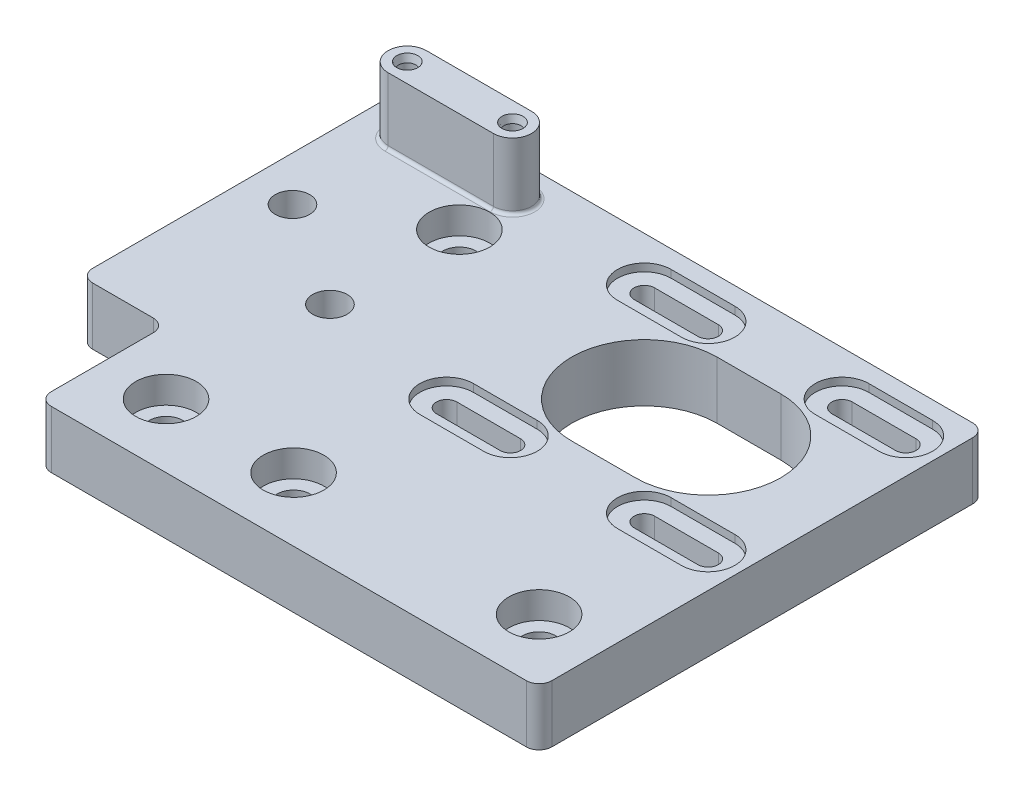
from build123d import *

# Parameters (mm, degrees)
SKETCH3_R           = 2.6
SKETCH3_R_2         = 2.7
BOSS_EXTRUDE1_DEPTH = 9
SKETCH5_R           = 4.75
CUT_EXTRUDE2_DEPTH  = 2.2
SKETCH6_R           = 4.75
CUT_EXTRUDE3_DEPTH  = 2
FILLET1_R           = 2
SKETCH7_R           = 1.35
BOSS_EXTRUDE2_DEPTH = 10.4
FILLET2_R           = 0.5
CHAMFER1_SIZE       = 0.3
CHAMFER1_SIZE2      = 1.119615242
CUT_EXTRUDE4_DEPTH  = 1.2
CUT_EXTRUDE8_DEPTH  = 0.4


# Read off the part's stored shape, not the designer's step: Cut-Extrude8
with BuildPart() as part:
    # Sketch3 → Boss-Extrude1 (new body)
    with BuildSketch(Plane(origin=(0, 0, 0), x_dir=(1, 0, 0), z_dir=(0, 1, 0))):
        Polygon((0, 0), (78.5, 0), (78.5, 70), (0, 70), (-13.5, 70), (-13.5, 20), (0, 20), align=None)
        with Locations(Location((10, 56, 0), (0, 0, 270))):
            Circle(SKETCH3_R, mode=Mode.SUBTRACT)
        with Locations(Location((10, 10, 0), (0, 0, 270))):
            Circle(SKETCH3_R, mode=Mode.SUBTRACT)
        with Locations(Location((68.5, 10, 0), (0, 0, 270))):
            Circle(SKETCH3_R, mode=Mode.SUBTRACT)
        with Locations(Location((10, 35.7, 0), (0, 0, 270))):
            Circle(SKETCH3_R_2, mode=Mode.SUBTRACT)
        with Locations(Location((-6.5, 46.325, 0), (0, 0, 270))):
            Circle(SKETCH3_R_2, mode=Mode.SUBTRACT)
        with Locations(Location((30, 10, 0), (0, 0, 270))):
            Circle(SKETCH3_R, mode=Mode.SUBTRACT)
        with BuildLine():
            Line((47.5, 58.9), (57.5, 58.9))
            ThreePointArc((57.5, 58.9), (68.9, 47.5), (57.5, 36.1))
            Line((57.5, 36.1), (47.5, 36.1))
            ThreePointArc((47.5, 36.1), (36.1, 47.5), (47.5, 58.9))
        make_face(mode=Mode.SUBTRACT)
        with BuildLine():
            Line((32, 64.6), (42, 64.6))
            ThreePointArc((42, 64.6), (43.6, 63), (42, 61.4))
            Line((42, 61.4), (32, 61.4))
            ThreePointArc((32, 61.4), (30.4, 63), (32, 64.6))
        make_face(mode=Mode.SUBTRACT)
        with BuildLine():
            Line((63, 64.6), (73, 64.6))
            ThreePointArc((73, 64.6), (74.6, 63), (73, 61.4))
            Line((73, 61.4), (63, 61.4))
            ThreePointArc((63, 61.4), (61.4, 63), (63, 64.6))
        make_face(mode=Mode.SUBTRACT)
        with BuildLine():
            Line((63, 33.6), (73, 33.6))
            ThreePointArc((73, 33.6), (74.6, 32), (73, 30.4))
            Line((73, 30.4), (63, 30.4))
            ThreePointArc((63, 30.4), (61.4, 32), (63, 33.6))
        make_face(mode=Mode.SUBTRACT)
        with BuildLine():
            Line((32, 33.6), (42, 33.6))
            ThreePointArc((42, 33.6), (43.6, 32), (42, 30.4))
            Line((42, 30.4), (32, 30.4))
            ThreePointArc((32, 30.4), (30.4, 32), (32, 33.6))
        make_face(mode=Mode.SUBTRACT)
    extrude(amount=BOSS_EXTRUDE1_DEPTH)

    # Sketch5 → Cut-Extrude2 (cut)
    with BuildSketch(Plane(origin=(0, 9, 0), x_dir=(1, 0, 0), z_dir=(0, 1, 0))):
        with Locations(Location((10, 56, 0), (0, 0, 270))):
            Circle(SKETCH5_R)
        with Locations(Location((10, 10, 0), (0, 0, 270))):
            Circle(SKETCH5_R)
        with Locations(Location((30, 10, 0), (0, 0, 270))):
            Circle(SKETCH5_R)
        with Locations(Location((68.5, 10, 0), (0, 0, 270))):
            Circle(SKETCH5_R)
    extrude(amount=-CUT_EXTRUDE2_DEPTH, mode=Mode.SUBTRACT)

    # Sketch6 → Cut-Extrude3 (cut)
    with BuildSketch(Plane(origin=(0, 6.8, 0), x_dir=(1, 0, 0), z_dir=(0, 1, 0))):
        with Locations(Location((68.5, 10, 0), (0, 0, 270))):
            Circle(SKETCH6_R)
        with Locations(Location((30, 10, 0), (0, 0, 270))):
            Circle(SKETCH6_R)
        with Locations(Location((10, 10, 0), (0, 0, 270))):
            Circle(SKETCH6_R)
        with Locations(Location((10, 56, 0), (0, 0, 270))):
            Circle(SKETCH6_R)
    extrude(amount=-CUT_EXTRUDE3_DEPTH, mode=Mode.SUBTRACT)

    # Fillet1
    fillet1_edges = [part.edges().sort_by_distance(p)[0] for p in [
        (0, 4.5, -20),
        (-13.5, 4.5, -20),
        (-13.5, 4.5, -70),
        (78.5, 4.5, -70),
        (78.5, 4.5, 0),
        (0, 4.5, 0),
    ]]
    fillet(fillet1_edges, radius=FILLET1_R)

    # Sketch7 → Boss-Extrude2 (add)
    with BuildSketch(Plane(origin=(0, 9, 0), x_dir=(1, 0, 0), z_dir=(0, 1, 0))):
        with BuildLine():
            Line((-6.5, 67.325), (10, 67.325))
            ThreePointArc((10, 67.325), (13, 64.325), (10, 61.325))
            Line((10, 61.325), (-6.5, 61.325))
            ThreePointArc((-6.5, 61.325), (-9.5, 64.325), (-6.5, 67.325))
        make_face()
        with Locations(Location((-6.5, 64.325, 0), (0, 0, 270))):
            Circle(SKETCH7_R, mode=Mode.SUBTRACT)
        with Locations(Location((10, 64.325, 0), (0, 0, 270))):
            Circle(SKETCH7_R, mode=Mode.SUBTRACT)
    extrude(amount=BOSS_EXTRUDE2_DEPTH)

    # Fillet2
    fillet2_edges = [part.edges().sort_by_distance(p)[0] for p in [
        (-9.5, 9, -64.325),
        (1.75, 9, -61.325),
        (13, 9, -64.325),
        (1.75, 9, -67.325),
    ]]
    fillet(fillet2_edges, radius=FILLET2_R)

    # Chamfer1
    chamfer1_edges = [part.edges().sort_by_distance(p)[0] for p in [
        (-6.5, 19.4, -65.675),
        (10, 19.4, -65.675),
    ]]
    chamfer1_side = [part.faces().sort_by_distance(p)[0] for p in [
        (1.75, 19.4, -64.325),
    ]]
    chamfer(chamfer1_edges, length=CHAMFER1_SIZE, length2=CHAMFER1_SIZE2, reference=chamfer1_side[0])

    # Sketch8 → Cut-Extrude4 (cut)
    with BuildSketch(Plane(origin=(0, 9, 0), x_dir=(1, 0, 0), z_dir=(0, 1, 0))):
        with BuildLine():
            Line((73, 27.8), (63, 27.8))
            ThreePointArc((63, 27.8), (58.8, 32), (63, 36.2))
            Line((63, 36.2), (73, 36.2))
            ThreePointArc((73, 36.2), (77.2, 32), (73, 27.8))
        make_face()
        with BuildLine():
            Line((42, 27.8), (32, 27.8))
            ThreePointArc((32, 27.8), (27.8, 32), (32, 36.2))
            Line((32, 36.2), (42, 36.2))
            ThreePointArc((42, 36.2), (46.2, 32), (42, 27.8))
        make_face()
        with BuildLine():
            Line((42, 58.8), (32, 58.8))
            ThreePointArc((32, 58.8), (27.8, 63), (32, 67.2))
            Line((32, 67.2), (42, 67.2))
            ThreePointArc((42, 67.2), (46.2, 63), (42, 58.8))
        make_face()
        with BuildLine():
            Line((63, 67.2), (73, 67.2))
            ThreePointArc((73, 67.2), (77.2, 63), (73, 58.8))
            Line((73, 58.8), (63, 58.8))
            ThreePointArc((63, 58.8), (58.8, 63), (63, 67.2))
        make_face()
    extrude(amount=-CUT_EXTRUDE4_DEPTH, mode=Mode.SUBTRACT)

    # Cut-Extrude8 outline → Cut-Extrude8 (cut)
    # profile 1 of 5: a face of its own
    with BuildSketch(Plane(origin=(0, 0, 0), x_dir=(1, 0, 0), z_dir=(0, 1, 0))):
        with BuildLine():
            add(Edge.make_bspline(
                [(-7.865534856, 29.499038462), (-7.898701426, 29.499773867), (-7.964684743, 29.501236921), (-8.061387338, 29.520421256), (-8.155129491, 29.54792403), (-8.244842381, 29.587854753), (-8.330709621, 29.639591182), (-8.413673167, 29.701995481), (-8.492661015, 29.776846195), (-8.568080669, 29.860679805), (-8.636691682, 29.953510963), (-8.696737672, 30.053174237), (-8.747675208, 30.159265502), (-8.78981842, 30.27110517), (-8.821485046, 30.389214426), (-8.844231309, 30.512994831), (-8.858450312, 30.642694489), (-8.860497684, 30.731180266), (-8.861538462, 30.776161859)],
                knots=[0, 0, 0, 0, 0.055270353, 0.109957746, 0.163912222, 0.218089001, 0.273309497, 0.330913549, 0.390994211, 0.454640742, 0.518898068, 0.583342166, 0.648543366, 0.715052521, 0.782518585, 0.852333896, 0.924934189, 1, 1, 1, 1], degree=3))
            add(Edge.make_bspline(
                [(-8.861538462, 30.776161859), (-8.859014133, 30.848464171), (-8.854083533, 30.989687402), (-8.810898066, 31.193277323), (-8.741994972, 31.3825424), (-8.659747922, 31.527211124), (-8.578557849, 31.634040937), (-8.507651234, 31.710380525), (-8.428851682, 31.785347737), (-8.337305773, 31.854010608), (-8.239213168, 31.923450537), (-8.129587346, 31.986668527), (-8.011287945, 32.048099683), (-7.927657293, 32.085115737), (-7.884615385, 32.104166667)],
                knots=[0, 0, 0, 0, 0.122711942, 0.239684964, 0.351815855, 0.463766133, 0.520817793, 0.579448291, 0.640604145, 0.705297512, 0.773633881, 0.844669382, 0.920056508, 1, 1, 1, 1], degree=3))
            Line((-7.884615385, 32.104166667), (-7.884615385, 32.674038462))
            add(Edge.make_bspline(
                [(-7.884615385, 32.674038462), (-7.948537177, 32.658599705), (-8.073499053, 32.6284182), (-8.25203794, 32.565466888), (-8.420990615, 32.496888239), (-8.577193491, 32.414539435), (-8.723785786, 32.32471641), (-8.857442626, 32.221805186), (-8.981563292, 32.11055369), (-9.091714452, 31.987499853), (-9.191459761, 31.858452138), (-9.276504507, 31.721592185), (-9.349664042, 31.579673507), (-9.409935034, 31.431712823), (-9.455338484, 31.277269625), (-9.488280117, 31.117740166), (-9.509672567, 30.952706387), (-9.51176038, 30.840678616), (-9.512820513, 30.783794071)],
                knots=[0, 0, 0, 0, 0.072625346, 0.141976611, 0.208984928, 0.27395687, 0.336889347, 0.398744953, 0.460115885, 0.520824923, 0.580994459, 0.640151928, 0.698622451, 0.757271081, 0.816426694, 0.876254048, 0.937165293, 1, 1, 1, 1], degree=3))
            add(Edge.make_bspline(
                [(-9.512820513, 30.783794071), (-9.510318195, 30.700912524), (-9.505368142, 30.536957319), (-9.460166236, 30.296087219), (-9.388637782, 30.06380999), (-9.289806877, 29.842668069), (-9.167909894, 29.637257484), (-9.022831015, 29.45449326), (-8.857369425, 29.296852676), (-8.674611772, 29.164601448), (-8.47929392, 29.061051092), (-8.278270777, 28.984694386), (-8.072019201, 28.938209336), (-7.932759566, 28.932184898), (-7.862990785, 28.929166667)],
                knots=[0, 0, 0, 0, 0.090254249, 0.178539792, 0.266093034, 0.354630978, 0.441886153, 0.525746915, 0.608113634, 0.690197273, 0.770821484, 0.848326181, 0.92401174, 1, 1, 1, 1], degree=3))
            add(Edge.make_bspline(
                [(-7.862990785, 28.929166667), (-7.795849886, 28.931277753), (-7.664465566, 28.935408822), (-7.472656564, 28.970485688), (-7.291878232, 29.029515765), (-7.121369552, 29.111285191), (-6.962211629, 29.217133432), (-6.814046369, 29.345353897), (-6.676216611, 29.496851583), (-6.597259853, 29.611657656), (-6.556610577, 29.670763221)],
                knots=[0, 0, 0, 0, 0.128067549, 0.250608319, 0.370630166, 0.490072247, 0.610374764, 0.73431307, 0.863216504, 1, 1, 1, 1], degree=3))
            add(Edge.make_bspline(
                [(-6.556610577, 29.670763221), (-6.524111282, 29.60312808), (-6.459616424, 29.468906131), (-6.331122433, 29.28780155), (-6.186406305, 29.120890011), (-6.072210892, 29.028900677), (-6.014723558, 28.982592147)],
                knots=[0, 0, 0, 0, 0.253915889, 0.50389613, 0.750255389, 1, 1, 1, 1], degree=3))
            add(Edge.make_bspline(
                [(-6.014723558, 28.982592147), (-5.972890208, 28.952037141), (-5.88990856, 28.891427486), (-5.756492473, 28.816614447), (-5.621597628, 28.748743625), (-5.48160842, 28.695856798), (-5.338147381, 28.654901354), (-5.190968176, 28.625625981), (-5.039950621, 28.607439326), (-4.937783693, 28.604834824), (-4.886428285, 28.603525641)],
                knots=[0, 0, 0, 0, 0.12813551, 0.254172712, 0.378111645, 0.501712263, 0.623986309, 0.747095614, 0.872874637, 1, 1, 1, 1], degree=3))
            add(Edge.make_bspline(
                [(-4.886428285, 28.603525641), (-4.797511103, 28.60678187), (-4.620095184, 28.613279006), (-4.357969942, 28.671336502), (-4.101773115, 28.761376538), (-3.856606129, 28.889099604), (-3.627439789, 29.045462257), (-3.420883147, 29.229429791), (-3.246118586, 29.44363225), (-3.098329118, 29.680306564), (-2.981291575, 29.937824375), (-2.896935169, 30.212135203), (-2.846338267, 30.501651577), (-2.840267173, 30.699637353), (-2.837179487, 30.800330529)],
                knots=[0, 0, 0, 0, 0.079641442, 0.15890809, 0.239599009, 0.322581849, 0.405999924, 0.487842619, 0.569675599, 0.653019991, 0.737412348, 0.822558452, 0.909755371, 1, 1, 1, 1], degree=3))
            add(Edge.make_bspline(
                [(-2.837179487, 30.800330529), (-2.838768413, 30.868215557), (-2.841894889, 31.001790657), (-2.862887543, 31.198236149), (-2.902271295, 31.385355199), (-2.951801814, 31.564964806), (-3.020283305, 31.734354225), (-3.10192593, 31.895959963), (-3.198823306, 32.049073648), (-3.311138386, 32.192785987), (-3.436858322, 32.326943442), (-3.578071675, 32.448128124), (-3.732142914, 32.557680815), (-3.900457934, 32.654905429), (-4.082545311, 32.740211148), (-4.279134699, 32.811762186), (-4.488702053, 32.87423508), (-4.634705154, 32.903337545), (-4.709615385, 32.918269231)],
                knots=[0, 0, 0, 0, 0.065537725, 0.128956388, 0.190367128, 0.249965467, 0.308568754, 0.366415243, 0.424556413, 0.483181137, 0.542251435, 0.60174426, 0.662507715, 0.724499557, 0.789138915, 0.856353952, 0.92629911, 1, 1, 1, 1], degree=3))
            Line((-4.709615385, 32.918269231), (-4.709615385, 32.348397436))
            add(Edge.make_bspline(
                [(-4.709615385, 32.348397436), (-4.660722175, 32.333550607), (-4.565620635, 32.304672236), (-4.428750366, 32.255515438), (-4.303277898, 32.199511573), (-4.188282805, 32.139432302), (-4.082632589, 32.076334264), (-3.989120913, 32.005731471), (-3.903640474, 31.932853165), (-3.855480964, 31.877917767), (-3.831911058, 31.851031651)],
                knots=[0, 0, 0, 0, 0.149770386, 0.29131641, 0.425966373, 0.552159574, 0.671527414, 0.786121629, 0.895325073, 1, 1, 1, 1], degree=3))
            add(Edge.make_bspline(
                [(-3.831911058, 31.851031651), (-3.804511526, 31.815473891), (-3.749797039, 31.74446813), (-3.679774452, 31.628833937), (-3.619836792, 31.506796701), (-3.57111695, 31.377338716), (-3.534546079, 31.240442617), (-3.508224087, 31.09666371), (-3.490847483, 30.945766092), (-3.489268453, 30.842781417), (-3.488461538, 30.790154247)],
                knots=[0, 0, 0, 0, 0.118260427, 0.236155811, 0.355630221, 0.476249447, 0.60016412, 0.728633077, 0.861326231, 1, 1, 1, 1], degree=3))
            add(Edge.make_bspline(
                [(-3.488461538, 30.790154247), (-3.489578967, 30.730730035), (-3.491764001, 30.614531118), (-3.511858497, 30.444977302), (-3.541123676, 30.28367379), (-3.586322945, 30.132411482), (-3.642168204, 29.98920899), (-3.712287454, 29.856073711), (-3.794555735, 29.731257919), (-3.888062494, 29.616360283), (-3.990427206, 29.513044862), (-4.097493778, 29.42207746), (-4.208810783, 29.344744145), (-4.324994231, 29.282362511), (-4.445563003, 29.233103655), (-4.570855451, 29.199569848), (-4.699846205, 29.176253528), (-4.787528763, 29.174354675), (-4.831730769, 29.173397436)],
                knots=[0, 0, 0, 0, 0.076071737, 0.148751715, 0.218402794, 0.285759581, 0.350598024, 0.414964045, 0.478069339, 0.541760676, 0.604349859, 0.664075021, 0.721463623, 0.777587128, 0.832644447, 0.887843511, 0.943460343, 1, 1, 1, 1], degree=3))
            add(Edge.make_bspline(
                [(-4.831730769, 29.173397436), (-4.890893271, 29.176179682), (-5.008923891, 29.181730331), (-5.182639599, 29.223931247), (-5.350073828, 29.293970624), (-5.50905801, 29.390100998), (-5.654609473, 29.509982861), (-5.785404644, 29.647948337), (-5.893227905, 29.807750794), (-5.967792657, 29.954720369), (-6.01865729, 30.084926283), (-6.052539632, 30.196350532), (-6.081229932, 30.321094901), (-6.107922254, 30.457649487), (-6.13063954, 30.607043631), (-6.149583982, 30.769114562), (-6.164742412, 30.94389516), (-6.171511685, 31.064891989), (-6.175, 31.12724359)],
                knots=[0, 0, 0, 0, 0.066906624, 0.13348033, 0.20102742, 0.271634404, 0.34290514, 0.413858569, 0.4859963, 0.560246393, 0.599899498, 0.644068466, 0.691903727, 0.744697298, 0.801499375, 0.862862948, 0.929331085, 1, 1, 1, 1], degree=3))
            Line((-6.175, 31.12724359), (-6.826282051, 31.12724359))
            add(Edge.make_bspline(
                [(-6.826282051, 31.12724359), (-6.827807352, 31.048711293), (-6.830793996, 30.894939608), (-6.859668198, 30.669723739), (-6.906022646, 30.455277641), (-6.972255149, 30.25468403), (-7.050269039, 30.072203189), (-7.140411935, 29.913250471), (-7.242439135, 29.782010371), (-7.354397218, 29.677111783), (-7.47382099, 29.597381486), (-7.599054077, 29.540041762), (-7.730592943, 29.505867236), (-7.820395835, 29.501322735), (-7.865534856, 29.499038462)],
                knots=[0, 0, 0, 0, 0.110174284, 0.215728893, 0.318103522, 0.417657931, 0.51174192, 0.596260228, 0.673404587, 0.744145217, 0.810661996, 0.874048981, 0.936691285, 1, 1, 1, 1], degree=3))
        make_face()
    # profile 2 of 5: a face of its own
    with BuildSketch(Plane(origin=(0, 0, 0), x_dir=(1, 0, 0), z_dir=(0, 1, 0))):
        with BuildLine():
            add(Edge.make_bspline(
                [(-6.172455929, 33.488141026), (-6.075349118, 33.489336696), (-5.885716922, 33.491671626), (-5.608969538, 33.503439349), (-5.34773633, 33.527173113), (-5.101738784, 33.556427964), (-4.870862844, 33.597445078), (-4.655258951, 33.646867308), (-4.454163768, 33.70317659), (-4.269018116, 33.771516889), (-4.096764894, 33.846694323), (-3.935875438, 33.928403051), (-3.785056859, 34.016067153), (-3.645388142, 34.110982295), (-3.516993672, 34.213543114), (-3.400048027, 34.323232532), (-3.292589626, 34.438717907), (-3.197495953, 34.561561681), (-3.111740809, 34.68799732), (-3.03944429, 34.820159455), (-2.976803597, 34.954665702), (-2.925589054, 35.092858978), (-2.885871577, 35.23452592), (-2.858567975, 35.380137497), (-2.839375639, 35.528823706), (-2.837914073, 35.62933876), (-2.837179487, 35.679857772)],
                knots=[0, 0, 0, 0, 0.065068544, 0.127067203, 0.185531529, 0.240784906, 0.29300424, 0.34255566, 0.388955174, 0.432815094, 0.474671242, 0.514820742, 0.553655081, 0.591478648, 0.627861044, 0.663639447, 0.69882299, 0.733432938, 0.767629982, 0.801074092, 0.834250456, 0.866969953, 0.899711643, 0.932696478, 0.966173152, 1, 1, 1, 1], degree=3))
            add(Edge.make_bspline(
                [(-2.837179487, 35.679857772), (-2.838025589, 35.729939522), (-2.839693937, 35.828690957), (-2.856954564, 35.975017501), (-2.884704978, 36.117044218), (-2.923560813, 36.255471963), (-2.971122031, 36.391010905), (-3.033086516, 36.521814249), (-3.104449964, 36.649335881), (-3.185720862, 36.773237452), (-3.278836096, 36.89118359), (-3.381811162, 37.003865337), (-3.49728669, 37.108347723), (-3.62344464, 37.20612638), (-3.759943205, 37.29778148), (-3.906873989, 37.383325273), (-4.06448788, 37.461929564), (-4.233778283, 37.533872504), (-4.417302079, 37.597657948), (-4.616763138, 37.65378291), (-4.83418739, 37.698608194), (-5.068470928, 37.736604551), (-5.3200898, 37.76705153), (-5.589135037, 37.788264178), (-5.875095745, 37.801123707), (-6.071527096, 37.802286935), (-6.172455929, 37.802884615)],
                knots=[0, 0, 0, 0, 0.033788636, 0.066624595, 0.099289256, 0.131366957, 0.163592401, 0.196112574, 0.228912347, 0.262169615, 0.296004273, 0.330232406, 0.365075923, 0.400968417, 0.437876761, 0.475965588, 0.5156405, 0.556675159, 0.600028359, 0.646689742, 0.696419229, 0.749771655, 0.806850038, 0.867429686, 0.93188375, 1, 1, 1, 1], degree=3))
            add(Edge.make_bspline(
                [(-6.172455929, 37.802884615), (-6.274232619, 37.802289497), (-6.471935304, 37.80113347), (-6.760016012, 37.788273049), (-7.030272537, 37.766909214), (-7.282717812, 37.737631408), (-7.517417018, 37.702002505), (-7.73374292, 37.654440109), (-7.932696827, 37.600351213), (-8.114927234, 37.537663049), (-8.282890212, 37.466928594), (-8.439688197, 37.389938838), (-8.585095732, 37.30364939), (-8.721391513, 37.212953113), (-8.846493921, 37.114319211), (-8.961844371, 37.009862583), (-9.066470092, 36.897494082), (-9.160442732, 36.77830358), (-9.242843024, 36.653098886), (-9.315871013, 36.525301375), (-9.376023779, 36.392627591), (-9.425230397, 36.25682411), (-9.465398894, 36.117604708), (-9.492990537, 35.975004929), (-9.510320284, 35.828694214), (-9.511979196, 35.729940618), (-9.512820513, 35.679857772)],
                knots=[0, 0, 0, 0, 0.068589512, 0.133236115, 0.19429811, 0.251260502, 0.304490752, 0.354208515, 0.400450752, 0.443377719, 0.483978808, 0.523213317, 0.561000573, 0.597855694, 0.63347129, 0.66826456, 0.702637509, 0.736824644, 0.770429956, 0.803571572, 0.835925177, 0.868470046, 0.900853925, 0.933471482, 0.966260089, 1, 1, 1, 1], degree=3))
            add(Edge.make_bspline(
                [(-9.512820513, 35.679857772), (-9.512119745, 35.62933177), (-9.510725464, 35.528802808), (-9.49110012, 35.380711468), (-9.46576912, 35.235199626), (-9.425142369, 35.094474984), (-9.376527191, 34.955876711), (-9.312380237, 34.822851467), (-9.242615443, 34.690702757), (-9.157508262, 34.565433921), (-9.063450823, 34.443302154), (-8.956671582, 34.328816374), (-8.840125669, 34.219050019), (-8.711213768, 34.11814892), (-8.57191248, 34.021788598), (-8.421054061, 33.933626985), (-8.258972832, 33.851830484), (-8.086420179, 33.774861535), (-7.898786953, 33.707554222), (-7.69724347, 33.647712641), (-7.47996466, 33.598662339), (-7.248160901, 33.558098602), (-7.000683842, 33.52661342), (-6.738034899, 33.503699037), (-6.460049755, 33.491590778), (-6.269989027, 33.489310957), (-6.172455929, 33.488141026)],
                knots=[0, 0, 0, 0, 0.033787941, 0.067226111, 0.099841381, 0.132545412, 0.165129805, 0.198010643, 0.231279811, 0.26504391, 0.299215764, 0.33435884, 0.369695008, 0.406257575, 0.443803519, 0.482981531, 0.523084852, 0.565266777, 0.609342883, 0.656392591, 0.705887018, 0.758325752, 0.813832747, 0.872795218, 0.934722568, 1, 1, 1, 1], degree=3))
        make_face()
        with BuildLine():
            add(Edge.make_bspline(
                [(-6.175, 34.058012821), (-6.251322596, 34.059011021), (-6.400625909, 34.060963714), (-6.619280323, 34.068427664), (-6.826957546, 34.087701863), (-7.02455226, 34.109108837), (-7.21097067, 34.140672362), (-7.387773352, 34.174704398), (-7.552770034, 34.220426547), (-7.708543668, 34.269266884), (-7.853325475, 34.325165143), (-7.987786921, 34.386700052), (-8.112589539, 34.452409408), (-8.227347723, 34.52381286), (-8.332727122, 34.599915831), (-8.426302963, 34.683446945), (-8.512627194, 34.769101357), (-8.609403031, 34.890919987), (-8.708856179, 35.049105185), (-8.797889327, 35.247298768), (-8.850581546, 35.452420583), (-8.85788879, 35.591375101), (-8.861538462, 35.660777244)],
                knots=[0, 0, 0, 0, 0.065674183, 0.128472742, 0.188155033, 0.245079953, 0.299416443, 0.350785468, 0.399898966, 0.446624039, 0.491202067, 0.533319379, 0.573791467, 0.612460894, 0.649527759, 0.685458826, 0.720283941, 0.754012215, 0.819093017, 0.880506225, 0.940317709, 1, 1, 1, 1], degree=3))
            add(Edge.make_bspline(
                [(-8.861538462, 35.660777244), (-8.85787971, 35.731019987), (-8.850555541, 35.871633438), (-8.798133012, 36.078945762), (-8.709116673, 36.278478262), (-8.609594639, 36.437185097), (-8.512998243, 36.557523835), (-8.430783587, 36.642919026), (-8.34178288, 36.723739907), (-8.242992057, 36.79756499), (-8.136221667, 36.865506042), (-8.022645702, 36.93016834), (-7.89971564, 36.986842605), (-7.768027096, 37.039715761), (-7.62362346, 37.086061109), (-7.464003778, 37.124529556), (-7.288503097, 37.159550529), (-7.09631216, 37.184771337), (-6.888963545, 37.206979934), (-6.665305685, 37.221291238), (-6.425702458, 37.232411491), (-6.260241229, 37.232808363), (-6.175, 37.233012821)],
                knots=[0, 0, 0, 0, 0.060377325, 0.120864644, 0.182579107, 0.247625506, 0.28133595, 0.315119274, 0.349456844, 0.384605619, 0.421015843, 0.458236748, 0.496894331, 0.537315435, 0.580209802, 0.627167096, 0.678437709, 0.734024163, 0.793778449, 0.857735571, 0.926709146, 1, 1, 1, 1], degree=3))
            add(Edge.make_bspline(
                [(-6.175, 37.233012821), (-6.090184843, 37.232791357), (-5.925575277, 37.232361541), (-5.68679201, 37.221457852), (-5.463704658, 37.206281028), (-5.256400287, 37.187187711), (-5.065603422, 37.158592752), (-4.89052085, 37.126150024), (-4.731476645, 37.087236952), (-4.587080951, 37.040968778), (-4.455289065, 36.988264825), (-4.332588268, 36.930822404), (-4.217524325, 36.86856609), (-4.1103764, 36.800219764), (-4.012454257, 36.724432171), (-3.921275794, 36.644716832), (-3.840012117, 36.557482617), (-3.742532791, 36.436831192), (-3.641806854, 36.27754077), (-3.55409274, 36.076844423), (-3.498970407, 35.870617184), (-3.491960434, 35.730642799), (-3.488461538, 35.660777244)],
                knots=[0, 0, 0, 0, 0.072954934, 0.141591202, 0.205573473, 0.265314519, 0.320613326, 0.371476908, 0.418452665, 0.461363899, 0.501800896, 0.54047368, 0.577851872, 0.614276414, 0.649659668, 0.68428272, 0.718344019, 0.752067719, 0.81764277, 0.879715699, 0.939962376, 1, 1, 1, 1], degree=3))
            add(Edge.make_bspline(
                [(-3.488461538, 35.660777244), (-3.491525239, 35.590507264), (-3.497641773, 35.450216567), (-3.55102447, 35.244178769), (-3.637807782, 35.045811143), (-3.736955659, 34.889261516), (-3.831981945, 34.770491844), (-3.912907578, 34.685363934), (-4.003546821, 34.607239044), (-4.101334147, 34.533139304), (-4.208146043, 34.46517799), (-4.323466605, 34.403377683), (-4.447616715, 34.346983622), (-4.534284666, 34.314854351), (-4.578595753, 34.298427484)],
                knots=[0, 0, 0, 0, 0.112801787, 0.225203442, 0.3396628, 0.459731034, 0.521784425, 0.583968672, 0.648210364, 0.713910493, 0.781027, 0.85146622, 0.924058511, 1, 1, 1, 1], degree=3))
            add(Edge.make_bspline(
                [(-4.578595753, 34.298427484), (-4.635255423, 34.279283562), (-4.750298853, 34.240413192), (-4.928758622, 34.190317544), (-5.115997922, 34.150865177), (-5.310897776, 34.115371642), (-5.51489552, 34.091145383), (-5.727359959, 34.071645779), (-5.948451288, 34.060160104), (-6.098665057, 34.058736342), (-6.175, 34.058012821)],
                knots=[0, 0, 0, 0, 0.110588339, 0.224541754, 0.342503494, 0.464324098, 0.590756033, 0.722227475, 0.858842836, 1, 1, 1, 1], degree=3))
        make_face(mode=Mode.SUBTRACT)
    # profile 3 of 5: a face of its own
    with BuildSketch(Plane(origin=(0, 0, 0), x_dir=(1, 0, 0), z_dir=(0, 1, 0))):
        with BuildLine():
            Line((-9.35, 53.888461538), (-9.35, 52.643139022))
            add(Edge.make_bspline(
                [(-9.35, 52.643139022), (-9.349905845, 52.55748495), (-9.349725441, 52.393367943), (-9.344255831, 52.15802777), (-9.336950261, 51.944287257), (-9.326823112, 51.75260728), (-9.314855012, 51.582398074), (-9.298069169, 51.43442983), (-9.280542633, 51.307539493), (-9.262723796, 51.23150922), (-9.254597356, 51.196834936)],
                knots=[0, 0, 0, 0, 0.176955752, 0.33905508, 0.486318225, 0.618780923, 0.735618828, 0.838742477, 0.926457068, 1, 1, 1, 1], degree=3))
            add(Edge.make_bspline(
                [(-9.254597356, 51.196834936), (-9.242582777, 51.152941336), (-9.218836727, 51.066188434), (-9.171284345, 50.941176716), (-9.114867166, 50.822263875), (-9.050691364, 50.708919169), (-8.97559791, 50.603206992), (-8.894582451, 50.50160337), (-8.802409425, 50.407694905), (-8.701985998, 50.320209618), (-8.594585849, 50.239349395), (-8.478257655, 50.171412187), (-8.356474445, 50.112010007), (-8.227581084, 50.063374429), (-8.091452434, 50.027206992), (-7.949055911, 50.000356314), (-7.800231397, 49.98323533), (-7.698521412, 49.981601136), (-7.646744792, 49.980769231)],
                knots=[0, 0, 0, 0, 0.062471851, 0.123471632, 0.183383245, 0.243116301, 0.30208086, 0.361286468, 0.421409958, 0.482490292, 0.544101288, 0.60572054, 0.66718551, 0.730025387, 0.794582117, 0.860366825, 0.928918151, 1, 1, 1, 1], degree=3))
            add(Edge.make_bspline(
                [(-7.646744792, 49.980769231), (-7.594533682, 49.981533816), (-7.492379121, 49.983029778), (-7.342931348, 50.000984467), (-7.200113697, 50.025169243), (-7.064242837, 50.062356752), (-6.936125653, 50.111062473), (-6.813804275, 50.168198055), (-6.699359728, 50.237111031), (-6.592376529, 50.316295222), (-6.492754259, 50.404381687), (-6.401214846, 50.500997732), (-6.318294118, 50.605753305), (-6.24380618, 50.718315488), (-6.179478359, 50.839781642), (-6.121861534, 50.968309549), (-6.07347261, 51.105016371), (-6.04801807, 51.199617789), (-6.035076122, 51.247716346)],
                knots=[0, 0, 0, 0, 0.070118894, 0.137192353, 0.202016181, 0.264631407, 0.326116547, 0.386010305, 0.445811847, 0.505297697, 0.564633278, 0.624282625, 0.683902032, 0.743952771, 0.805387731, 0.868388031, 0.933084028, 1, 1, 1, 1], degree=3))
            add(Edge.make_bspline(
                [(-6.035076122, 51.247716346), (-6.026622447, 51.287499248), (-6.008095727, 51.37468579), (-5.987272212, 51.518264297), (-5.970194654, 51.685517169), (-5.954257741, 51.875875338), (-5.945813169, 52.089782713), (-5.935897865, 52.326748695), (-5.931219375, 52.587575256), (-5.930923636, 52.769493651), (-5.930769231, 52.864473157)],
                knots=[0, 0, 0, 0, 0.075171591, 0.164742911, 0.268011437, 0.385963956, 0.517799273, 0.663697808, 0.824416787, 1, 1, 1, 1], degree=3))
            Line((-5.930769231, 52.864473157), (-5.930769231, 53.318589744))
            Line((-5.930769231, 53.318589744), (-3, 53.318589744))
            Line((-3, 53.318589744), (-3, 53.888461538))
            Line((-3, 53.888461538), (-9.35, 53.888461538))
        make_face()
        with BuildLine():
            add(Edge.make_bspline(
                [(-6.568058894, 52.206830929), (-6.568029003, 52.152547256), (-6.567971299, 52.047753743), (-6.575226188, 51.896381672), (-6.583489537, 51.755921879), (-6.595987371, 51.626902551), (-6.612370052, 51.508870985), (-6.632743555, 51.402846684), (-6.654892794, 51.307243884), (-6.691898677, 51.197271383), (-6.74879902, 51.073658668), (-6.831630162, 50.938621213), (-6.938933951, 50.825064756), (-7.059244184, 50.726978735), (-7.192723916, 50.647609094), (-7.336290482, 50.591616979), (-7.48781696, 50.557139346), (-7.591440189, 50.55283342), (-7.644200721, 50.550641026)],
                knots=[0, 0, 0, 0, 0.072546636, 0.140049785, 0.202518751, 0.260604744, 0.313264025, 0.361727231, 0.404889876, 0.444318965, 0.516599455, 0.586409107, 0.654995623, 0.724301928, 0.79341098, 0.861610032, 0.929537725, 1, 1, 1, 1], degree=3))
            add(Edge.make_bspline(
                [(-7.644200721, 50.550641026), (-7.695251974, 50.55293185), (-7.796735547, 50.557485725), (-7.945469177, 50.591332456), (-8.087408291, 50.648210345), (-8.219813091, 50.727048124), (-8.339858593, 50.822753749), (-8.444319266, 50.93390257), (-8.527733626, 51.060778938), (-8.583646515, 51.177819386), (-8.616381537, 51.282627668), (-8.640024852, 51.373214608), (-8.656328546, 51.476020192), (-8.671929149, 51.590067609), (-8.684521948, 51.71521206), (-8.693266869, 51.852248934), (-8.698331108, 52.000721883), (-8.69858588, 52.103792006), (-8.698717949, 52.157221554)],
                knots=[0, 0, 0, 0, 0.070033802, 0.139218531, 0.20816787, 0.279133704, 0.349937079, 0.418294398, 0.487540294, 0.557576515, 0.59549021, 0.638118047, 0.68595741, 0.738222369, 0.796131621, 0.858536649, 0.926668148, 1, 1, 1, 1], degree=3))
            Line((-8.698717949, 52.157221554), (-8.698717949, 53.318589744))
            Line((-8.698717949, 53.318589744), (-6.582051282, 53.318589744))
            Line((-6.582051282, 53.318589744), (-6.568058894, 52.206830929))
        make_face(mode=Mode.SUBTRACT)
    # profile 4 of 5: a face of its own
    with BuildSketch(Plane(origin=(0, 0, 0), x_dir=(1, 0, 0), z_dir=(0, 1, 0))):
        Polygon((-9.35, 61.435446715), (-9.35, 61.354036458), (-4.13974359, 58.732371795), (-9.35, 56.117067308), (-9.35, 56.034385016), (-3, 55.191025641), (-3, 55.763441506), (-7.569150641, 56.371474359), (-3, 58.663681891), (-3, 58.792157452), (-7.579326923, 61.093269231), (-3, 61.700030048), (-3, 62.273717949), align=None)
    # profile 5 of 5: a face of its own
    with BuildSketch(Plane(origin=(0, 0, 0), x_dir=(1, 0, 0), z_dir=(0, 1, 0))):
        Polygon((-9.35, 66.018589744), (-9.35, 65.448717949), (-3.651282051, 65.448717949), (-3.651282051, 63.006410256), (-3, 63.006410256), (-3, 66.018589744), align=None)
    extrude(amount=CUT_EXTRUDE8_DEPTH, mode=Mode.SUBTRACT)


solid = part.part
